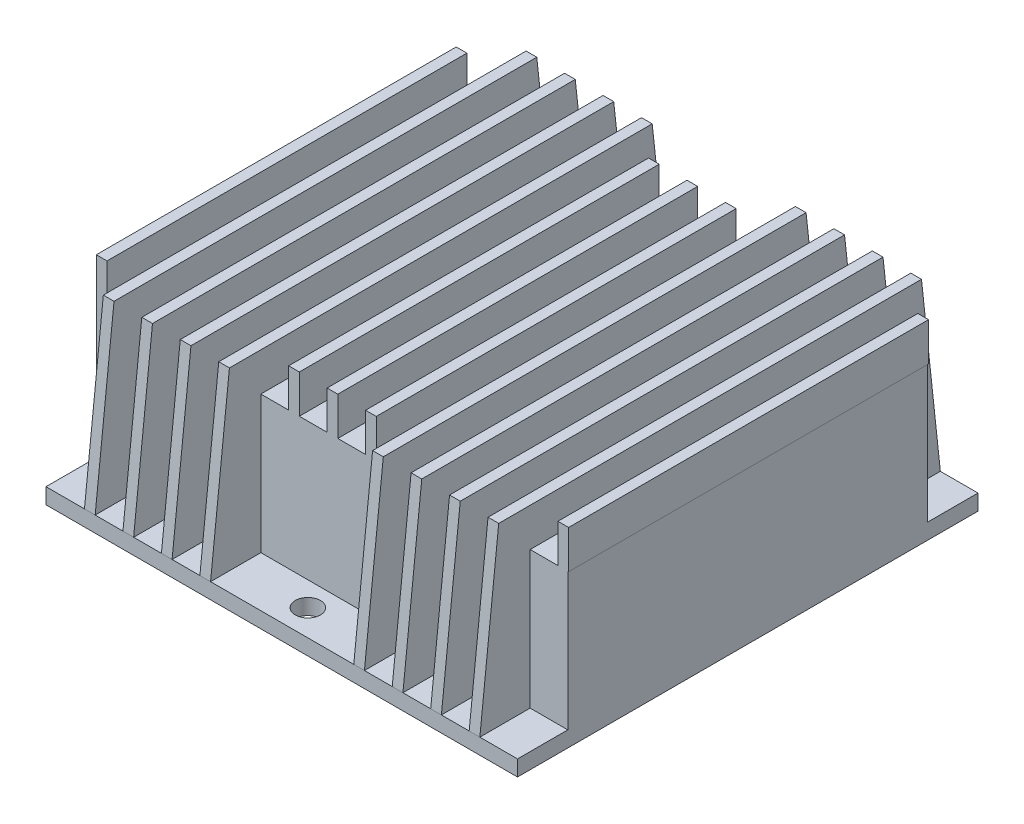
from build123d import *

# Parameters (mm, degrees)
SKETCH1_W                      = 75
SKETCH1_H                      = 73.25
BOSS_EXTRUDE1_DEPTH            = 2.5
SKETCH2_W                      = 75
SKETCH2_H                      = 57.25
BOSS_EXTRUDE2_DEPTH            = 21.85
BOSS_EXTRUDE3_DEPTH            = 1.7
LPATTERN1_COUNT                = 13
LPATTERN1_PITCH                = 6.119230769
CUT_EXTRUDE1_REACH             = 59.883
SKETCH4_W                      = 1.7
SKETCH4_H                      = 8
CUT_EXTRUDE1_DIRECTION_2_REACH = 59.883
SKETCH5_R                      = 2
CUT_EXTRUDE2_DEPTH             = 60.486703707
SKETCH6_W                      = 31.6
SKETCH6_H                      = 16.5
BOSS_EXTRUDE4_DEPTH            = 2.5


with BuildPart() as part:
    # Sketch1 → Boss-Extrude1 (new body)
    with BuildSketch(Plane(origin=(0, 0, 0), x_dir=(1, 0, 0), z_dir=(0, 1, 0))):
        Rectangle(SKETCH1_W, SKETCH1_H)
    extrude(amount=BOSS_EXTRUDE1_DEPTH)

    # Sketch2 → Boss-Extrude2 (add)
    with BuildSketch(Plane(origin=(0, 2.5, 0), x_dir=(1, 0, 0), z_dir=(0, 1, 0))):
        Rectangle(SKETCH2_W, SKETCH2_H)
    extrude(amount=BOSS_EXTRUDE2_DEPTH)

    # Sketch3 → Boss-Extrude3 (add)
    with BuildSketch(Plane.ZY.offset(37.5)):
        Polygon((-33.625, 30.45), (33.625, 30.45), (36.625, 2.5), (28.625, 2.5), (28.625, 24.35), (-28.625, 24.35), (-28.625, 2.5), (-36.625, 2.5), align=None)
    boss_extrude3 = extrude(amount=-BOSS_EXTRUDE3_DEPTH)

    # LPattern1: Boss-Extrude3 ×13
    with Locations(*[(i * LPATTERN1_PITCH, 0, 0) for i in range(1, LPATTERN1_COUNT)]):
        add(boss_extrude3)

    # Cut-Extrude1: up to this face of the body (flat: up to its plane)
    cut_extrude1_end = Plane(part.part.faces().sort_by_distance((33.721153846, 2.5, -32.625))[0])
    # Sketch4 → Cut-Extrude1 (cut, up to the picked face)
    with BuildSketch(Plane(origin=(0, 24.35, 0), x_dir=(1, 0, 0), z_dir=(0, 1, 0)), mode=Mode.PRIVATE) as cut_extrude1_sk1:
        with Locations((-36.65, -32.625)):
            Rectangle(SKETCH4_W, SKETCH4_H)
    cut_extrude1_tool1 = split(extrude(cut_extrude1_sk1.sketch, amount=-CUT_EXTRUDE1_REACH, mode=Mode.PRIVATE), bisect_by=cut_extrude1_end, keep=Keep.BOTH, mode=Mode.PRIVATE)
    # Sketch4 → Cut-Extrude1 (cut, up to the picked face)
    with BuildSketch(Plane(origin=(0, 24.35, 0), x_dir=(1, 0, 0), z_dir=(0, 1, 0)), mode=Mode.PRIVATE) as cut_extrude1_sk2:
        with Locations((-6.053846154, -32.625)):
            Rectangle(SKETCH4_W, SKETCH4_H)
    cut_extrude1_tool2 = split(extrude(cut_extrude1_sk2.sketch, amount=-CUT_EXTRUDE1_REACH, mode=Mode.PRIVATE), bisect_by=cut_extrude1_end, keep=Keep.BOTH, mode=Mode.PRIVATE)
    # Sketch4 → Cut-Extrude1 (cut, up to the picked face)
    with BuildSketch(Plane(origin=(0, 24.35, 0), x_dir=(1, 0, 0), z_dir=(0, 1, 0)), mode=Mode.PRIVATE) as cut_extrude1_sk3:
        with Locations((0.065384615, -32.625)):
            Rectangle(SKETCH4_W, SKETCH4_H)
    cut_extrude1_tool3 = split(extrude(cut_extrude1_sk3.sketch, amount=-CUT_EXTRUDE1_REACH, mode=Mode.PRIVATE), bisect_by=cut_extrude1_end, keep=Keep.BOTH, mode=Mode.PRIVATE)
    # Sketch4 → Cut-Extrude1 (cut, up to the picked face)
    with BuildSketch(Plane(origin=(0, 24.35, 0), x_dir=(1, 0, 0), z_dir=(0, 1, 0)), mode=Mode.PRIVATE) as cut_extrude1_sk4:
        with Locations((6.184615385, -32.625)):
            Rectangle(SKETCH4_W, SKETCH4_H)
    cut_extrude1_tool4 = split(extrude(cut_extrude1_sk4.sketch, amount=-CUT_EXTRUDE1_REACH, mode=Mode.PRIVATE), bisect_by=cut_extrude1_end, keep=Keep.BOTH, mode=Mode.PRIVATE)
    # Sketch4 → Cut-Extrude1 (cut, up to the picked face)
    with BuildSketch(Plane(origin=(0, 24.35, 0), x_dir=(1, 0, 0), z_dir=(0, 1, 0)), mode=Mode.PRIVATE) as cut_extrude1_sk5:
        with Locations((36.780769231, -32.625)):
            Rectangle(SKETCH4_W, SKETCH4_H)
    cut_extrude1_tool5 = split(extrude(cut_extrude1_sk5.sketch, amount=-CUT_EXTRUDE1_REACH, mode=Mode.PRIVATE), bisect_by=cut_extrude1_end, keep=Keep.BOTH, mode=Mode.PRIVATE)
    # Sketch4 → Cut-Extrude1 (cut, up to the picked face)
    with BuildSketch(Plane(origin=(0, 24.35, 0), x_dir=(1, 0, 0), z_dir=(0, 1, 0)), mode=Mode.PRIVATE) as cut_extrude1_sk6:
        with Locations((-36.65, 32.625)):
            Rectangle(SKETCH4_W, SKETCH4_H)
    cut_extrude1_tool6 = split(extrude(cut_extrude1_sk6.sketch, amount=-CUT_EXTRUDE1_REACH, mode=Mode.PRIVATE), bisect_by=cut_extrude1_end, keep=Keep.BOTH, mode=Mode.PRIVATE)
    # Sketch4 → Cut-Extrude1 (cut, up to the picked face)
    with BuildSketch(Plane(origin=(0, 24.35, 0), x_dir=(1, 0, 0), z_dir=(0, 1, 0)), mode=Mode.PRIVATE) as cut_extrude1_sk7:
        with Locations((-6.053846154, 32.625)):
            Rectangle(SKETCH4_W, SKETCH4_H)
    cut_extrude1_tool7 = split(extrude(cut_extrude1_sk7.sketch, amount=-CUT_EXTRUDE1_REACH, mode=Mode.PRIVATE), bisect_by=cut_extrude1_end, keep=Keep.BOTH, mode=Mode.PRIVATE)
    # Sketch4 → Cut-Extrude1 (cut, up to the picked face)
    with BuildSketch(Plane(origin=(0, 24.35, 0), x_dir=(1, 0, 0), z_dir=(0, 1, 0)), mode=Mode.PRIVATE) as cut_extrude1_sk8:
        with Locations((6.184615385, 32.625)):
            Rectangle(SKETCH4_W, SKETCH4_H)
    cut_extrude1_tool8 = split(extrude(cut_extrude1_sk8.sketch, amount=-CUT_EXTRUDE1_REACH, mode=Mode.PRIVATE), bisect_by=cut_extrude1_end, keep=Keep.BOTH, mode=Mode.PRIVATE)
    # Sketch4 → Cut-Extrude1 (cut, up to the picked face)
    with BuildSketch(Plane(origin=(0, 24.35, 0), x_dir=(1, 0, 0), z_dir=(0, 1, 0)), mode=Mode.PRIVATE) as cut_extrude1_sk9:
        with Locations((36.780769231, 32.625)):
            Rectangle(SKETCH4_W, SKETCH4_H)
    cut_extrude1_tool9 = split(extrude(cut_extrude1_sk9.sketch, amount=-CUT_EXTRUDE1_REACH, mode=Mode.PRIVATE), bisect_by=cut_extrude1_end, keep=Keep.BOTH, mode=Mode.PRIVATE)
    # Sketch4 → Cut-Extrude1 (cut, up to the picked face)
    with BuildSketch(Plane(origin=(0, 24.35, 0), x_dir=(1, 0, 0), z_dir=(0, 1, 0)), mode=Mode.PRIVATE) as cut_extrude1_sk10:
        with Locations((0.065384615, 32.625)):
            Rectangle(SKETCH4_W, SKETCH4_H)
    cut_extrude1_tool10 = split(extrude(cut_extrude1_sk10.sketch, amount=-CUT_EXTRUDE1_REACH, mode=Mode.PRIVATE), bisect_by=cut_extrude1_end, keep=Keep.BOTH, mode=Mode.PRIVATE)
    add(cut_extrude1_tool1.solids().sort_by(Axis((-36.65, 24.35, 32.625), (0, -1, 0)))[0], mode=Mode.SUBTRACT)
    add(cut_extrude1_tool2.solids().sort_by(Axis((-6.053846, 24.35, 32.625), (0, -1, 0)))[0], mode=Mode.SUBTRACT)
    add(cut_extrude1_tool3.solids().sort_by(Axis((0.065385, 24.35, 32.625), (0, -1, 0)))[0], mode=Mode.SUBTRACT)
    add(cut_extrude1_tool4.solids().sort_by(Axis((6.184615, 24.35, 32.625), (0, -1, 0)))[0], mode=Mode.SUBTRACT)
    add(cut_extrude1_tool5.solids().sort_by(Axis((36.780769, 24.35, 32.625), (0, -1, 0)))[0], mode=Mode.SUBTRACT)
    add(cut_extrude1_tool6.solids().sort_by(Axis((-36.65, 24.35, -32.625), (0, -1, 0)))[0], mode=Mode.SUBTRACT)
    add(cut_extrude1_tool7.solids().sort_by(Axis((-6.053846, 24.35, -32.625), (0, -1, 0)))[0], mode=Mode.SUBTRACT)
    add(cut_extrude1_tool8.solids().sort_by(Axis((6.184615, 24.35, -32.625), (0, -1, 0)))[0], mode=Mode.SUBTRACT)
    add(cut_extrude1_tool9.solids().sort_by(Axis((36.780769, 24.35, -32.625), (0, -1, 0)))[0], mode=Mode.SUBTRACT)
    add(cut_extrude1_tool10.solids().sort_by(Axis((0.065385, 24.35, -32.625), (0, -1, 0)))[0], mode=Mode.SUBTRACT)

    # Cut-Extrude1 direction 2: up to this face of the body (flat: up to its plane)
    cut_extrude1_direction_2_end = Plane(part.part.faces().sort_by_distance((36.780769231, 30.45, 0))[0])
    # Sketch4 → Cut-Extrude1 direction 2 (cut, up to the picked face)
    with BuildSketch(Plane(origin=(0, 24.35, 0), x_dir=(1, 0, 0), z_dir=(0, 1, 0)), mode=Mode.PRIVATE) as cut_extrude1_direction_2_sk1:
        with Locations((-36.65, -32.625)):
            Rectangle(SKETCH4_W, SKETCH4_H)
    cut_extrude1_direction_2_tool1 = split(extrude(cut_extrude1_direction_2_sk1.sketch, amount=CUT_EXTRUDE1_DIRECTION_2_REACH, mode=Mode.PRIVATE), bisect_by=cut_extrude1_direction_2_end, keep=Keep.BOTH, mode=Mode.PRIVATE)
    # Sketch4 → Cut-Extrude1 direction 2 (cut, up to the picked face)
    with BuildSketch(Plane(origin=(0, 24.35, 0), x_dir=(1, 0, 0), z_dir=(0, 1, 0)), mode=Mode.PRIVATE) as cut_extrude1_direction_2_sk2:
        with Locations((-6.053846154, -32.625)):
            Rectangle(SKETCH4_W, SKETCH4_H)
    cut_extrude1_direction_2_tool2 = split(extrude(cut_extrude1_direction_2_sk2.sketch, amount=CUT_EXTRUDE1_DIRECTION_2_REACH, mode=Mode.PRIVATE), bisect_by=cut_extrude1_direction_2_end, keep=Keep.BOTH, mode=Mode.PRIVATE)
    # Sketch4 → Cut-Extrude1 direction 2 (cut, up to the picked face)
    with BuildSketch(Plane(origin=(0, 24.35, 0), x_dir=(1, 0, 0), z_dir=(0, 1, 0)), mode=Mode.PRIVATE) as cut_extrude1_direction_2_sk3:
        with Locations((0.065384615, -32.625)):
            Rectangle(SKETCH4_W, SKETCH4_H)
    cut_extrude1_direction_2_tool3 = split(extrude(cut_extrude1_direction_2_sk3.sketch, amount=CUT_EXTRUDE1_DIRECTION_2_REACH, mode=Mode.PRIVATE), bisect_by=cut_extrude1_direction_2_end, keep=Keep.BOTH, mode=Mode.PRIVATE)
    # Sketch4 → Cut-Extrude1 direction 2 (cut, up to the picked face)
    with BuildSketch(Plane(origin=(0, 24.35, 0), x_dir=(1, 0, 0), z_dir=(0, 1, 0)), mode=Mode.PRIVATE) as cut_extrude1_direction_2_sk4:
        with Locations((6.184615385, -32.625)):
            Rectangle(SKETCH4_W, SKETCH4_H)
    cut_extrude1_direction_2_tool4 = split(extrude(cut_extrude1_direction_2_sk4.sketch, amount=CUT_EXTRUDE1_DIRECTION_2_REACH, mode=Mode.PRIVATE), bisect_by=cut_extrude1_direction_2_end, keep=Keep.BOTH, mode=Mode.PRIVATE)
    # Sketch4 → Cut-Extrude1 direction 2 (cut, up to the picked face)
    with BuildSketch(Plane(origin=(0, 24.35, 0), x_dir=(1, 0, 0), z_dir=(0, 1, 0)), mode=Mode.PRIVATE) as cut_extrude1_direction_2_sk5:
        with Locations((36.780769231, -32.625)):
            Rectangle(SKETCH4_W, SKETCH4_H)
    cut_extrude1_direction_2_tool5 = split(extrude(cut_extrude1_direction_2_sk5.sketch, amount=CUT_EXTRUDE1_DIRECTION_2_REACH, mode=Mode.PRIVATE), bisect_by=cut_extrude1_direction_2_end, keep=Keep.BOTH, mode=Mode.PRIVATE)
    # Sketch4 → Cut-Extrude1 direction 2 (cut, up to the picked face)
    with BuildSketch(Plane(origin=(0, 24.35, 0), x_dir=(1, 0, 0), z_dir=(0, 1, 0)), mode=Mode.PRIVATE) as cut_extrude1_direction_2_sk6:
        with Locations((-36.65, 32.625)):
            Rectangle(SKETCH4_W, SKETCH4_H)
    cut_extrude1_direction_2_tool6 = split(extrude(cut_extrude1_direction_2_sk6.sketch, amount=CUT_EXTRUDE1_DIRECTION_2_REACH, mode=Mode.PRIVATE), bisect_by=cut_extrude1_direction_2_end, keep=Keep.BOTH, mode=Mode.PRIVATE)
    # Sketch4 → Cut-Extrude1 direction 2 (cut, up to the picked face)
    with BuildSketch(Plane(origin=(0, 24.35, 0), x_dir=(1, 0, 0), z_dir=(0, 1, 0)), mode=Mode.PRIVATE) as cut_extrude1_direction_2_sk7:
        with Locations((-6.053846154, 32.625)):
            Rectangle(SKETCH4_W, SKETCH4_H)
    cut_extrude1_direction_2_tool7 = split(extrude(cut_extrude1_direction_2_sk7.sketch, amount=CUT_EXTRUDE1_DIRECTION_2_REACH, mode=Mode.PRIVATE), bisect_by=cut_extrude1_direction_2_end, keep=Keep.BOTH, mode=Mode.PRIVATE)
    # Sketch4 → Cut-Extrude1 direction 2 (cut, up to the picked face)
    with BuildSketch(Plane(origin=(0, 24.35, 0), x_dir=(1, 0, 0), z_dir=(0, 1, 0)), mode=Mode.PRIVATE) as cut_extrude1_direction_2_sk8:
        with Locations((6.184615385, 32.625)):
            Rectangle(SKETCH4_W, SKETCH4_H)
    cut_extrude1_direction_2_tool8 = split(extrude(cut_extrude1_direction_2_sk8.sketch, amount=CUT_EXTRUDE1_DIRECTION_2_REACH, mode=Mode.PRIVATE), bisect_by=cut_extrude1_direction_2_end, keep=Keep.BOTH, mode=Mode.PRIVATE)
    # Sketch4 → Cut-Extrude1 direction 2 (cut, up to the picked face)
    with BuildSketch(Plane(origin=(0, 24.35, 0), x_dir=(1, 0, 0), z_dir=(0, 1, 0)), mode=Mode.PRIVATE) as cut_extrude1_direction_2_sk9:
        with Locations((36.780769231, 32.625)):
            Rectangle(SKETCH4_W, SKETCH4_H)
    cut_extrude1_direction_2_tool9 = split(extrude(cut_extrude1_direction_2_sk9.sketch, amount=CUT_EXTRUDE1_DIRECTION_2_REACH, mode=Mode.PRIVATE), bisect_by=cut_extrude1_direction_2_end, keep=Keep.BOTH, mode=Mode.PRIVATE)
    # Sketch4 → Cut-Extrude1 direction 2 (cut, up to the picked face)
    with BuildSketch(Plane(origin=(0, 24.35, 0), x_dir=(1, 0, 0), z_dir=(0, 1, 0)), mode=Mode.PRIVATE) as cut_extrude1_direction_2_sk10:
        with Locations((0.065384615, 32.625)):
            Rectangle(SKETCH4_W, SKETCH4_H)
    cut_extrude1_direction_2_tool10 = split(extrude(cut_extrude1_direction_2_sk10.sketch, amount=CUT_EXTRUDE1_DIRECTION_2_REACH, mode=Mode.PRIVATE), bisect_by=cut_extrude1_direction_2_end, keep=Keep.BOTH, mode=Mode.PRIVATE)
    add(cut_extrude1_direction_2_tool1.solids().sort_by(Axis((-36.65, 24.35, 32.625), (0, 1, 0)))[0], mode=Mode.SUBTRACT)
    add(cut_extrude1_direction_2_tool2.solids().sort_by(Axis((-6.053846, 24.35, 32.625), (0, 1, 0)))[0], mode=Mode.SUBTRACT)
    add(cut_extrude1_direction_2_tool3.solids().sort_by(Axis((0.065385, 24.35, 32.625), (0, 1, 0)))[0], mode=Mode.SUBTRACT)
    add(cut_extrude1_direction_2_tool4.solids().sort_by(Axis((6.184615, 24.35, 32.625), (0, 1, 0)))[0], mode=Mode.SUBTRACT)
    add(cut_extrude1_direction_2_tool5.solids().sort_by(Axis((36.780769, 24.35, 32.625), (0, 1, 0)))[0], mode=Mode.SUBTRACT)
    add(cut_extrude1_direction_2_tool6.solids().sort_by(Axis((-36.65, 24.35, -32.625), (0, 1, 0)))[0], mode=Mode.SUBTRACT)
    add(cut_extrude1_direction_2_tool7.solids().sort_by(Axis((-6.053846, 24.35, -32.625), (0, 1, 0)))[0], mode=Mode.SUBTRACT)
    add(cut_extrude1_direction_2_tool8.solids().sort_by(Axis((6.184615, 24.35, -32.625), (0, 1, 0)))[0], mode=Mode.SUBTRACT)
    add(cut_extrude1_direction_2_tool9.solids().sort_by(Axis((36.780769, 24.35, -32.625), (0, 1, 0)))[0], mode=Mode.SUBTRACT)
    add(cut_extrude1_direction_2_tool10.solids().sort_by(Axis((0.065385, 24.35, -32.625), (0, 1, 0)))[0], mode=Mode.SUBTRACT)

    # Sketch5 → Cut-Extrude2 (cut, through all)
    with BuildSketch(Plane(origin=(0, 2.5, 0), x_dir=(1, 0, 0), z_dir=(0, 1, 0))):
        with Locations((0, 32.475)):
            Circle(SKETCH5_R)
        with Locations((0, -32.475)):
            Circle(SKETCH5_R)
    extrude(amount=-CUT_EXTRUDE2_DEPTH, mode=Mode.SUBTRACT)

    # Sketch6 → Boss-Extrude4 (add)
    with BuildSketch(Plane.ZY.offset(37.5)):
        with Locations((0, 8.25)):
            Rectangle(SKETCH6_W, SKETCH6_H)
    extrude(amount=BOSS_EXTRUDE4_DEPTH)


solid = part.part
